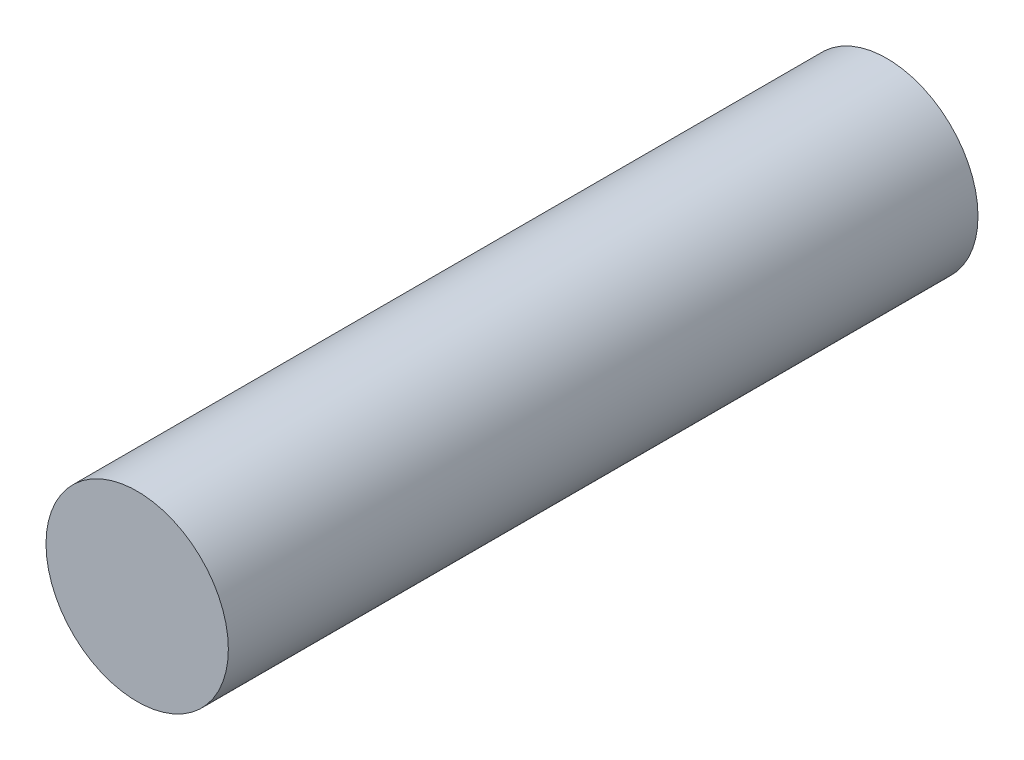
from build123d import *

# Parameters (mm, degrees)
SKETCH1_R           = 2.25
BOSS_EXTRUDE1_DEPTH = 9.25


with BuildPart() as part:
    # Sketch1 → Boss-Extrude1 (new, symmetric)
    with BuildSketch(Plane.XY):
        Circle(SKETCH1_R)
    extrude(amount=BOSS_EXTRUDE1_DEPTH, both=True)


solid = part.part
